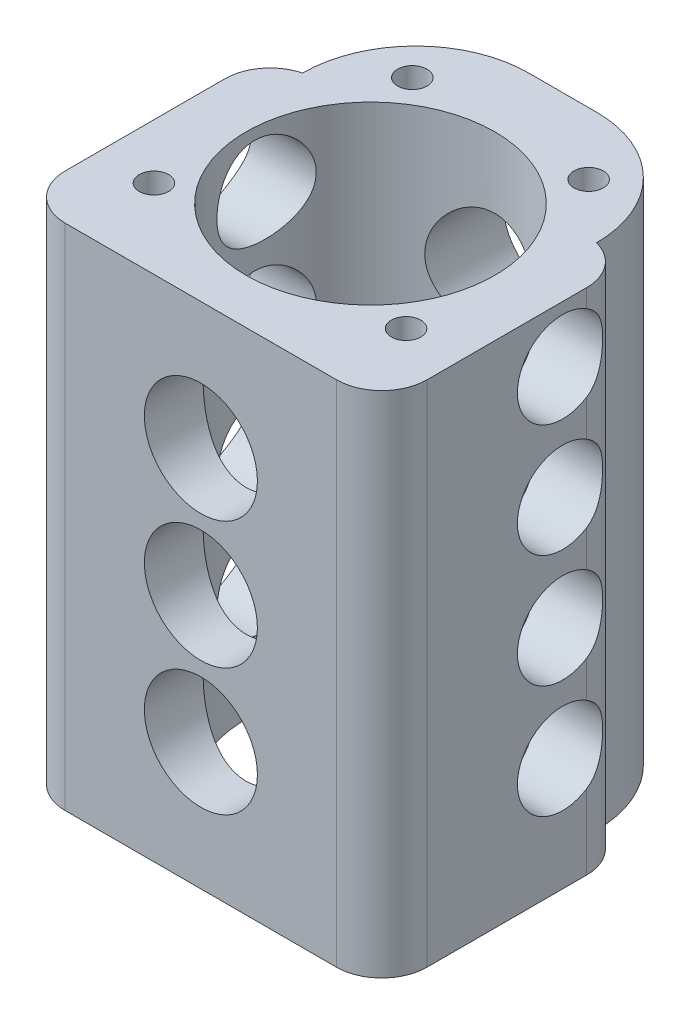
from build123d import *

# Parameters (mm, degrees)
EXTRUDE_1_DEPTH     = 45
SKETCH_2_W          = 3
SKETCH_2_H          = 10
SKETCH_2_R          = 1.3
SKETCH_2_R_2        = 11
CUT_EXTRUDE_1_DEPTH = 51.368641038
FILLET_1_R          = 10
FILLET_3_R          = 4
FILLET_4_R          = 4
CUT_EXTRUDE_2_DEPTH = 58.489129407
SKETCH_5_R          = 5
CUT_EXTRUDE_3_DEPTH = 58.489129541
SKETCH_6_R          = 4
CUT_EXTRUDE_4_DEPTH = 58.489129513


# Some blends are built 0.0001 mm under size
with BuildPart() as part:
    # 草图1 → 凸台-拉伸1 (new body)
    with BuildSketch(Plane(origin=(0, 0, 0), x_dir=(1, 0, 0), z_dir=(0, 1, 0))):
        Polygon((0, 16), (16, 16), (16, -16), (-16, -16), (-16, 16), align=None)
    extrude(amount=EXTRUDE_1_DEPTH)

    # 草图2 → 切除-拉伸1 (cut, through all)
    with BuildSketch(Plane(origin=(0, 45, 0), x_dir=(1, 0, 0), z_dir=(0, 1, 0))):
        with Locations((-14.5, 11)):
            Rectangle(SKETCH_2_W, SKETCH_2_H)
        with Locations((14.5, 11)):
            Rectangle(SKETCH_2_W, SKETCH_2_H)
        with Locations(Location((-11.15, -9, 0), (0, 0, 270))):
            Circle(SKETCH_2_R)
        with Locations(Location((11.15, -9, 0), (0, 0, 270))):
            Circle(SKETCH_2_R)
        with Locations(Location((-7.8, 10.5, 0), (0, 0, 270))):
            Circle(SKETCH_2_R)
        with Locations(Location((7.8, 10.5, 0), (0, 0, 270))):
            Circle(SKETCH_2_R)
        with Locations(Location((0, -1, 0), (0, 0, 270))):
            Circle(SKETCH_2_R_2)
    extrude(amount=-CUT_EXTRUDE_1_DEPTH, mode=Mode.SUBTRACT)

    # 圆角1
    fillet_1_edges = [part.edges().sort_by_distance(p)[0] for p in [
        (-13, 22.5, -16),
        (13, 22.5, -16),
    ]]
    fillet(fillet_1_edges, radius=FILLET_1_R - 0.0001)  # a hair under: the kernel refuses the full size

    # 圆角3
    fillet_3_edges = [part.edges().sort_by_distance(p)[0] for p in [
        (16, 22.5, 16),
        (-16, 22.5, 16),
    ]]
    fillet(fillet_3_edges, radius=FILLET_3_R)

    # 圆角4
    # the kernel refuses this fillet: 4 mm, written as the material it takes off along each edge
    with BuildSketch(Plane(origin=(16, 54.682458366, -6), x_dir=(0, 0, 1), z_dir=(0, -1, 0))) as fillet_4_piece_1:
        with BuildLine():
            CenterArc((3.872983346, 4), FILLET_4_R, 194.477512186, 75.522487814)
            Line((0, 3), (-0.077459667, 2.98))
            ThreePointArc((-0.077459667, 2.98), (-0.08, 1.5), (-0.08, 0))
            Line((-0.08, 0), (0, -0.08))
            Line((0, -0.08), (3.872983346, -0.08))
            Line((3.872983346, -0.08), (3.872983346, 0))
        make_face()
    extrude(amount=64.364916731, mode=Mode.SUBTRACT)
    with BuildSketch(Plane(origin=(-16, 54.682458366, -6), x_dir=(0, 0, 1), z_dir=(0, -1, 0))) as fillet_4_piece_2:
        with BuildLine():
            CenterArc((3.872983346, -4), FILLET_4_R, 90, 75.522487814)
            Line((0, -3), (-0.077459667, -2.98))
            ThreePointArc((-0.077459667, -2.98), (-0.08, -1.5), (-0.08, 0))
            Line((-0.08, 0), (0, 0.08))
            Line((0, 0.08), (3.872983346, 0.08))
            Line((3.872983346, 0.08), (3.872983346, 0))
        make_face()
    extrude(amount=64.364916731, mode=Mode.SUBTRACT)

    # 草图4 → 切除-拉伸2 (cut, through all)
    with BuildSketch(Plane.ZY.offset(16)):
        with BuildLine():
            Line((-16, 36), (-16, 34))
            ThreePointArc((-16, 34), (-15, 35), (-16, 36))
        make_face()
        with BuildLine():
            ThreePointArc((-16, 11), (-15, 10), (-16, 9))
            Line((-16, 9), (-16, 11))
        make_face()
    extrude(amount=-CUT_EXTRUDE_2_DEPTH, mode=Mode.SUBTRACT)

    # 草图5 → 切除-拉伸3 (cut, through all)
    with BuildSketch(Plane.XY.offset(16)):
        with Locations((0, 22.5)):
            Circle(SKETCH_5_R)
        with Locations((0, 33.75)):
            Circle(SKETCH_5_R)
        with Locations((0, 11.25)):
            Circle(SKETCH_5_R)
    extrude(amount=-CUT_EXTRUDE_3_DEPTH, mode=Mode.SUBTRACT)

    # 草图6 → 切除-拉伸4 (cut, through all)
    with BuildSketch(Plane.ZY.offset(16)):
        with Locations((0, 30)):
            Circle(SKETCH_6_R)
        with Locations((0, 20)):
            Circle(SKETCH_6_R)
        with Locations((0, 10)):
            Circle(SKETCH_6_R)
        with Locations((0, 40)):
            Circle(SKETCH_6_R)
    extrude(amount=-CUT_EXTRUDE_4_DEPTH, mode=Mode.SUBTRACT)


solid = part.part
